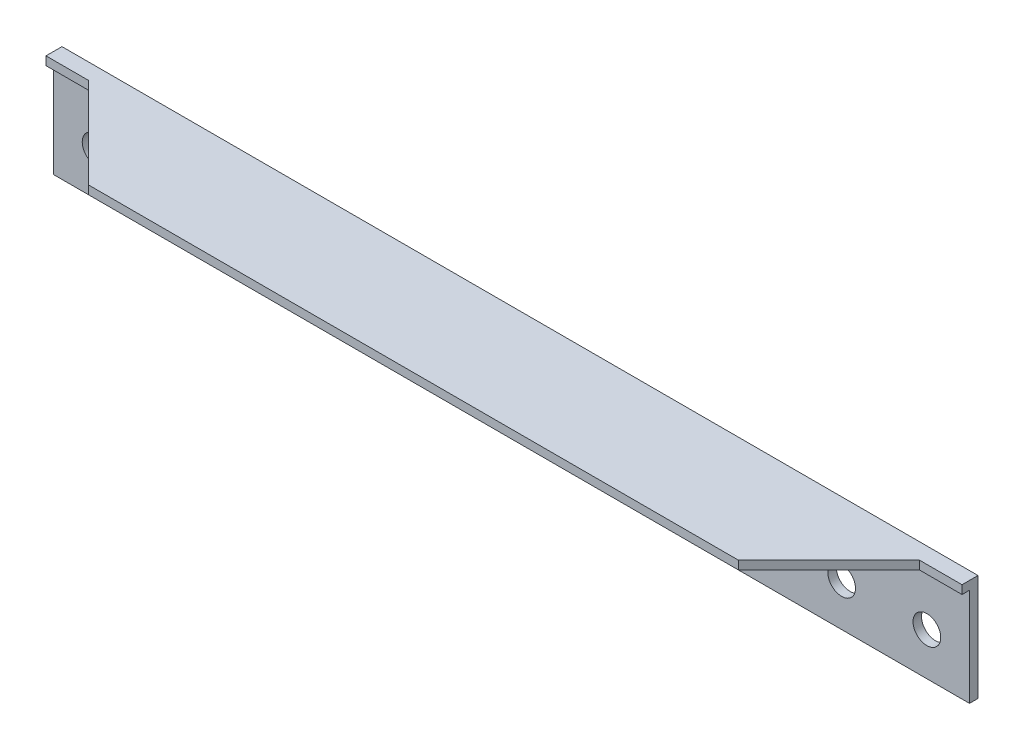
from build123d import *

# Parameters (mm, degrees)
SKETCH_1_W          = 860
SKETCH_1_H          = 100
SKETCH_1_R          = 13
EXTRUDE_1_DEPTH     = 8
SKETCH_2_W          = 860
SKETCH_2_H          = 8
EXTRUDE_2_DEPTH     = 92
CUT_EXTRUDE_1_DEPTH = 453.65881191


with BuildPart() as part:
    # 草图1 → 凸台-拉伸1 (new body)
    with BuildSketch(Plane.XY):
        with Locations((0, 50)):
            Rectangle(SKETCH_1_W, SKETCH_1_H)
        with Locations((390, 40)):
            Circle(SKETCH_1_R, mode=Mode.SUBTRACT)
        with Locations((310, 40)):
            Circle(SKETCH_1_R, mode=Mode.SUBTRACT)
        with Locations((-390, 40)):
            Circle(SKETCH_1_R, mode=Mode.SUBTRACT)
        with Locations((-310, 40)):
            Circle(SKETCH_1_R, mode=Mode.SUBTRACT)
    extrude(amount=EXTRUDE_1_DEPTH)

    # 草图2 → 凸台-拉伸2 (add)
    with BuildSketch(Plane.XY.offset(8)):
        with Locations((0, 96)):
            Rectangle(SKETCH_2_W, SKETCH_2_H)
    extrude(amount=EXTRUDE_2_DEPTH)

    # 草图4 → 切除-拉伸1 (cut, through all)
    with BuildSketch(Plane(origin=(0, 100, 0), x_dir=(1, 0, 0), z_dir=(0, 1, 0))):
        Polygon((-430, -15), (-390, -15), (-305, -100), (-430, -100), align=None)
    cut_extrude_1 = extrude(amount=-CUT_EXTRUDE_1_DEPTH, mode=Mode.SUBTRACT)

    # 镜向1: 切除-拉伸1 across plane
    add(cut_extrude_1.mirror(Plane(origin=(0, 0, 0), x_dir=(0, 0, 1), z_dir=(1, 0, 0))), mode=Mode.SUBTRACT)


solid = part.part
